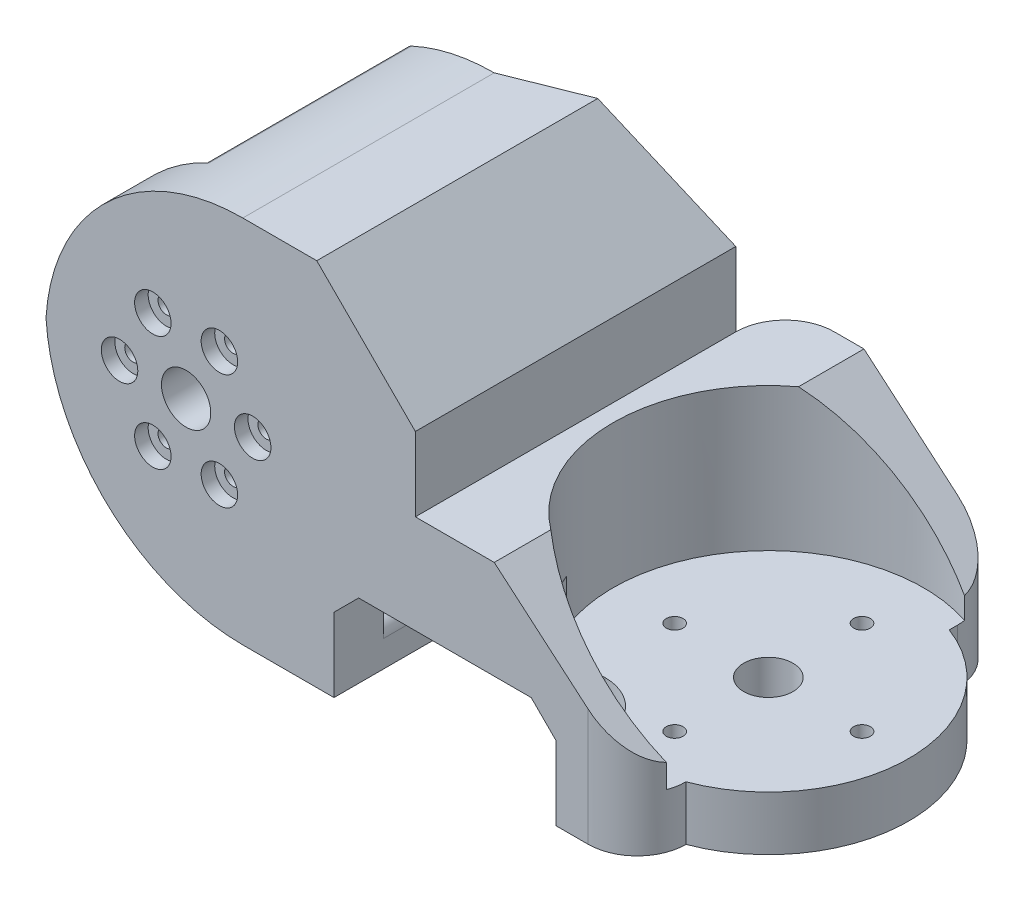
from build123d import *

# Parameters (mm, degrees)
SKETCH_1_W           = 140
SKETCH_1_H           = 75
EXTRUDE_1_DEPTH      = 75
SKETCH_2_R           = 5
SKETCH_2_R_2         = 1.7
CUT_EXTRUDE_3_DEPTH  = 75
SKETCH_3_R           = 30
CUT_EXTRUDE_4_DEPTH  = 65
SKETCH_5_W           = 86.110755756
SKETCH_5_H           = 127.816531237
CUT_EXTRUDE_5_DEPTH  = 65
SKETCH_6_R           = 5
SKETCH_6_R_2         = 1.7
CUT_EXTRUDE_6_DEPTH  = 110.230261375
SKETCH_7_R           = 31.5
CUT_EXTRUDE_8_DEPTH  = 64
SKETCH_8_W           = 81.607165619
SKETCH_8_H           = 101.959181743
CUT_EXTRUDE_9_DEPTH  = 35
SKETCH_9_W           = 88.154882568
SKETCH_9_H           = 60
CUT_EXTRUDE_10_DEPTH = 41
SKETCH_10_W          = 45
SKETCH_10_H          = 50
CUT_EXTRUDE_11_DEPTH = 20
FILLET_2_R           = 10
SKETCH_12_W          = 15
SKETCH_12_H          = 75
CUT_EXTRUDE_13_DEPTH = 29
CUT_EXTRUDE_14_DEPTH = 90
CUT_EXTRUDE_15_DEPTH = 20
CHAMFER_1_SIZE       = 5
CHAMFER_2_SIZE       = 5
CHAMFER_3_SIZE       = 3.631453243
CHAMFER_4_SIZE       = 25
CUT_EXTRUDE_16_DEPTH = 90
FILLET_4_R           = 40
FILLET_9_R           = 10
CUT_EXTRUDE_17_DEPTH = 90
FILLET_10_R          = 10
FILLET_11_R          = 2
FILLET_12_R          = 15
CHAMFER_5_SIZE       = 20
FILLET_13_R          = 3
SKETCH_20_R          = 3.7
CUT_EXTRUDE_18_DEPTH = 2.75
SKETCH_21_R          = 3.7
CUT_EXTRUDE_19_DEPTH = 5.5
EXTRUDE_START        = 7.25
SKETCH_22_R          = 28
SKETCH_22_R_2        = 5
SKETCH_22_R_3        = 1.7
EXTRUDE_2_DEPTH      = 7.25


# Some blends are built 0.0001 mm under size
with BuildPart() as part:
    # 草图1 → 凸台-拉伸1 (new body)
    with BuildSketch(Plane(origin=(0, 0, 0), x_dir=(1, 0, 0), z_dir=(0, 1, 0))):
        Rectangle(SKETCH_1_W, SKETCH_1_H)
    extrude(amount=EXTRUDE_1_DEPTH)

    # 草图2 → 切除-拉伸3 (cut)
    with BuildSketch(Plane(origin=(0, 0, -37.5), x_dir=(-1, 0, 0), z_dir=(0, 0, -1))):
        with Locations((41.5, 37.5)):
            Circle(SKETCH_2_R)
        with Locations((55, 37.5)):
            Circle(SKETCH_2_R_2)
        with Locations((48.25, 25.808657049)):
            Circle(SKETCH_2_R_2)
        with Locations((34.75, 25.808657049)):
            Circle(SKETCH_2_R_2)
        with Locations((28, 37.5)):
            Circle(SKETCH_2_R_2)
        with Locations((34.75, 49.191342951)):
            Circle(SKETCH_2_R_2)
        with Locations((48.25, 49.191342951)):
            Circle(SKETCH_2_R_2)
    extrude(amount=-CUT_EXTRUDE_3_DEPTH, mode=Mode.SUBTRACT)

    # 草图3 → 切除-拉伸4 (cut)
    with BuildSketch(Plane(origin=(0, 0, -37.5), x_dir=(-1, 0, 0), z_dir=(0, 0, -1))):
        with Locations((41.5, 37.5)):
            Circle(SKETCH_3_R)
    extrude(amount=-CUT_EXTRUDE_4_DEPTH, mode=Mode.SUBTRACT)

    # 草图5 → 切除-拉伸5 (cut)
    with BuildSketch(Plane.ZY.offset(70)):
        with Locations((-56.555377878, 38.847801736)):
            Rectangle(SKETCH_5_W, SKETCH_5_H)
    extrude(amount=-CUT_EXTRUDE_5_DEPTH, mode=Mode.SUBTRACT)

    # 草图6 → 切除-拉伸6 (cut, through all)
    with BuildSketch(Plane(origin=(0, 75, 0), x_dir=(1, 0, 0), z_dir=(0, 1, 0))):
        with Locations(Location((40, -0.9, 0), (0, 0, 270))):
            Circle(SKETCH_6_R)
        with Locations(Location((59, -0.9, 0), (0, 0, 270))):
            Circle(SKETCH_6_R_2)
        with Locations(Location((40, -19.9, 0), (0, 0, 270))):
            Circle(SKETCH_6_R_2)
        with Locations(Location((21, -0.9, 0), (0, 0, 270))):
            Circle(SKETCH_6_R_2)
        with Locations(Location((40, 18.1, 0), (0, 0, 270))):
            Circle(SKETCH_6_R_2)
    extrude(amount=-CUT_EXTRUDE_6_DEPTH, mode=Mode.SUBTRACT)

    # 草图7 → 切除-拉伸8 (cut)
    with BuildSketch(Plane(origin=(0, 75, 0), x_dir=(1, 0, 0), z_dir=(0, 1, 0))):
        with Locations((40, -0.9)):
            Circle(SKETCH_7_R)
    extrude(amount=-CUT_EXTRUDE_8_DEPTH, mode=Mode.SUBTRACT)

    # 草图8 → 切除-拉伸9 (cut)
    with BuildSketch(Plane(origin=(0, 75, 0), x_dir=(1, 0, 0), z_dir=(0, 1, 0))):
        with Locations((45.803582809, 9.868709537)):
            Rectangle(SKETCH_8_W, SKETCH_8_H)
    extrude(amount=-CUT_EXTRUDE_9_DEPTH, mode=Mode.SUBTRACT)

    # 草图9 → 切除-拉伸10 (cut)
    with BuildSketch(Plane(origin=(0, 0, -13.5), x_dir=(-1, 0, 0), z_dir=(0, 0, -1))):
        with Locations((49.077441284, 37.5)):
            Rectangle(SKETCH_9_W, SKETCH_9_H)
    extrude(amount=-CUT_EXTRUDE_10_DEPTH, mode=Mode.SUBTRACT)

    # 草图10 → 切除-拉伸11 (cut)
    with BuildSketch(Plane.XY.offset(37.5)):
        with Locations((11, -5)):
            Rectangle(SKETCH_10_W, SKETCH_10_H)
    extrude(amount=-CUT_EXTRUDE_11_DEPTH, mode=Mode.SUBTRACT)

    # 圆角2
    fillet_2_edges = [part.edges().sort_by_distance(p)[0] for p in [
        (33.5, 5.5, 17.5),
    ]]
    fillet(fillet_2_edges, radius=FILLET_2_R)

    # 草图12 → 切除-拉伸13 (cut)
    with BuildSketch(Plane(origin=(0, 40, 0), x_dir=(1, 0, 0), z_dir=(0, 1, 0))):
        with Locations((62.5, 0)):
            Rectangle(SKETCH_12_W, SKETCH_12_H)
    extrude(amount=-CUT_EXTRUDE_13_DEPTH, mode=Mode.SUBTRACT)

    # 草图13 → 切除-拉伸14 (cut)
    with BuildSketch(Plane.XY.offset(37.5)):
        Polygon((21, 40), (55, 11), (55, 40), align=None)
    extrude(amount=-CUT_EXTRUDE_14_DEPTH, mode=Mode.SUBTRACT)

    # 草图14 → 切除-拉伸15 (cut)
    with BuildSketch(Plane.XZ):
        with BuildLine():
            Line((50, -25.78801229), (50, -49.043195076))
            Line((50, -49.043195076), (107.000534674, -49.043195076))
            Line((107.000534674, -49.043195076), (107.000534674, 45.470511991))
            Line((107.000534674, 45.470511991), (50, 45.470511991))
            Line((50, 45.470511991), (50, 27.58801229))
            ThreePointArc((50, 27.58801229), (68.5, 0.9), (50, -25.78801229))
        make_face()
    extrude(amount=-CUT_EXTRUDE_15_DEPTH, mode=Mode.SUBTRACT)

    # 倒角1
    chamfer_1_edges = [part.edges().sort_by_distance(p)[0] for p in [
        (-11.5, 20, 32.5),
        (33.5, 20, 34.611035007),
    ]]
    chamfer(chamfer_1_edges, length=CHAMFER_1_SIZE)

    # 倒角2
    chamfer_2_edges = [part.edges().sort_by_distance(p)[0] for p in [
        (-5, 20, 22.5),
    ]]
    chamfer(chamfer_2_edges, length=CHAMFER_2_SIZE)

    # 倒角3
    # the kernel refuses this chamfer: 5, 3.631453243 mm, written as the material it takes off along each edge
    with BuildSketch(Plane(origin=(13.228933529, 11, 17.5), x_dir=(-0.4507563772017135, 0, -0.8926470122125466), z_dir=(0, 1, 0))) as chamfer_3_piece_1:
        with BuildLine():
            Line((5.501422933, 0), (CHAMFER_3_SIZE * 0.450756377234, CHAMFER_3_SIZE * 0.892647012276))
            Line((CHAMFER_3_SIZE * 0.450756377234, CHAMFER_3_SIZE * 0.892647012276), (0, 0))
            ThreePointArc((0, 0), (2.827778177, 0.120237365), (5.501422933, 0))
        make_face()
    extrude(amount=9, mode=Mode.SUBTRACT)

    # 倒角4
    # the kernel refuses this chamfer: 25 mm, written as the material it adds along each edge
    with BuildSketch(Plane(origin=(-5, 0, -13.5), x_dir=(0, 0, -1), z_dir=(0, 1, 0))) as chamfer_4_piece_1_section:
        Polygon((CHAMFER_4_SIZE, 0), (0, CHAMFER_4_SIZE), (0, 0), align=None)
    chamfer_4_piece_1 = extrude(amount=7.5, mode=Mode.PRIVATE)
    chamfer_4_piece_1 = split(chamfer_4_piece_1, bisect_by=Plane(origin=(-5, 0, -37.5), z_dir=(0, 0, 1)), keep=Keep.TOP, mode=Mode.PRIVATE)
    add(chamfer_4_piece_1)
    with BuildSketch(Plane(origin=(-5, 0, -13.5), x_dir=(0, 0, -1), z_dir=(0, 1, 0))) as chamfer_4_piece_2_section:
        Polygon((CHAMFER_4_SIZE, 0), (0, CHAMFER_4_SIZE), (0, 0), align=None)
    chamfer_4_piece_2 = extrude(amount=71.792074699, mode=Mode.PRIVATE)
    chamfer_4_piece_2 = split(chamfer_4_piece_2, bisect_by=Plane(origin=(-5, 0, -37.5), z_dir=(0, 0, 1)), keep=Keep.TOP, mode=Mode.PRIVATE)
    chamfer_4_piece_2 = split(chamfer_4_piece_2, bisect_by=Plane(origin=(-5, 67.5, -13.5), z_dir=(0, 1, 0)), keep=Keep.TOP, mode=Mode.PRIVATE)
    add(chamfer_4_piece_2)
    with BuildSketch(Plane(origin=(-5, 3.207925301, -13.5), x_dir=(0, 0, -1), z_dir=(0, 1, 0))) as chamfer_4_piece_3_section:
        Polygon((CHAMFER_4_SIZE, 0), (0, CHAMFER_4_SIZE), (0, 0), align=None)
    chamfer_4_piece_3 = extrude(amount=71.792074699, mode=Mode.PRIVATE)
    chamfer_4_piece_3 = split(chamfer_4_piece_3, bisect_by=Plane(origin=(-5, 3.207925301, -37.5), z_dir=(0, 0, 1)), keep=Keep.TOP, mode=Mode.PRIVATE)
    chamfer_4_piece_3 = split(chamfer_4_piece_3, bisect_by=Plane(origin=(-5, 7.5, -13.5), z_dir=(0, -1, 0)), keep=Keep.TOP, mode=Mode.PRIVATE)
    add(chamfer_4_piece_3)
    with BuildSketch(Plane(origin=(-5, 67.5, -13.5), x_dir=(0, 0, -1), z_dir=(0, 1, 0))) as chamfer_4_piece_4_section:
        Polygon((CHAMFER_4_SIZE, 0), (0, CHAMFER_4_SIZE), (0, 0), align=None)
    chamfer_4_piece_4 = extrude(amount=7.5, mode=Mode.PRIVATE)
    chamfer_4_piece_4 = split(chamfer_4_piece_4, bisect_by=Plane(origin=(-5, 67.5, -37.5), z_dir=(0, 0, 1)), keep=Keep.TOP, mode=Mode.PRIVATE)
    add(chamfer_4_piece_4)

    # 草图18 → 切除-拉伸16 (cut)
    with BuildSketch(Plane(origin=(0, 75, 0), x_dir=(1, 0, 0), z_dir=(0, 1, 0))):
        Polygon((5, 37.5), (-30, 13.5), (-17.082794304, 37.696917135), align=None)
    extrude(amount=-CUT_EXTRUDE_16_DEPTH, mode=Mode.SUBTRACT)

    # 圆角4
    # the kernel refuses this fillet: 40 mm, written as the material it takes off along each edge
    with BuildSketch(Plane(origin=(-70, 0, 137.5), x_dir=(0, 1, 0), z_dir=(0, 0, -1)), Plane(origin=(-70, 75, 137.5), x_dir=(1, 0, 0), z_dir=(0, 0, -1))) as fillet_4_piece_1:
        with BuildLine():
            CenterArc((FILLET_4_R, FILLET_4_R), FILLET_4_R, 180, 90)
            Line((0, FILLET_4_R), (0, 0))
            Line((0, 0), (FILLET_4_R, 0))
        make_face()
    extrude(amount=251, mode=Mode.SUBTRACT)

    # 圆角9
    # the kernel refuses this fillet: 10 mm, written as the material it takes off along each edge
    with BuildSketch(Plane(origin=(50, -25, -37.5), x_dir=(-1, 0, 0), z_dir=(0, 1, 0))) as fillet_9_piece_1:
        with BuildLine():
            CenterArc((FILLET_9_R, FILLET_9_R), FILLET_9_R, 180, 90)
            Line((0, FILLET_9_R), (0, 0))
            Line((0, 0), (FILLET_9_R, 0))
        make_face()
    extrude(amount=65.264705882, mode=Mode.SUBTRACT)
    with BuildSketch(Plane(origin=(50, 40.264705882, 37.5), x_dir=(-1, 0, 0), z_dir=(0, -1, 0))) as fillet_9_piece_2_section:
        with BuildLine():
            CenterArc((FILLET_9_R, FILLET_9_R), FILLET_9_R, 180, 90)
            Line((0, FILLET_9_R), (0, 0))
            Line((0, 0), (FILLET_9_R, 0))
        make_face()
    fillet_9_piece_2 = extrude(amount=65.264705882, mode=Mode.PRIVATE)
    fillet_9_piece_2 = fillet_9_piece_2 - Plane(origin=(40, 40.264705882, 0.9), x_dir=(0.35087719298245684, 0, 0.9364214838654397), z_dir=(0, -1, 0)) * Cylinder(28.5, 171, mode=Mode.PRIVATE)
    add(fillet_9_piece_2, mode=Mode.SUBTRACT)

    # 草图19 → 切除-拉伸17 (cut)
    with BuildSketch(Plane(origin=(0, 75, 0), x_dir=(1, 0, 0), z_dir=(0, 1, 0))):
        Polygon((-30, 13.5), (5, 27.5), (5, 42.665451474), align=None)
    extrude(amount=-CUT_EXTRUDE_17_DEPTH, mode=Mode.SUBTRACT)

    # 圆角10
    fillet_10_edges = [part.edges().sort_by_distance(p)[0] for p in [
        (5, 20, -37.5),
    ]]
    fillet(fillet_10_edges, radius=FILLET_10_R - 0.0001)  # a hair under: the kernel refuses the full size

    # 圆角11
    fillet_11_edges = [part.edges().sort_by_distance(p)[0] for p in [
        (-53.318447633, 7.5, 7),
        (-53.318447633, 67.5, 7),
    ]]
    fillet(fillet_11_edges, radius=FILLET_11_R)

    # 圆角12
    fillet_12_edges = [part.edges().sort_by_distance(p)[0] for p in [
        (-5, 7.5, -3),
        (-5, 67.5, 2),
    ]]
    fillet(fillet_12_edges, radius=FILLET_12_R)

    # 倒角5
    chamfer_5_edges = [part.edges().sort_by_distance(p)[0] for p in [
        (5, 75, 5),
    ]]
    chamfer(chamfer_5_edges, length=CHAMFER_5_SIZE)

    # 圆角13
    # the kernel refuses this fillet: 3 mm, written as the material it takes off along each edge
    with BuildSketch(Plane(origin=(-5, 32.5, 17.5), x_dir=(0, 0, -1), z_dir=(0, -1, 0))) as fillet_13_piece_1_section:
        with BuildLine():
            CenterArc((FILLET_13_R, FILLET_13_R), FILLET_13_R, 180, 90)
            Line((0, FILLET_13_R), (0, 0))
            Line((0, 0), (FILLET_13_R, 0))
        make_face()
    fillet_13_piece_1 = extrude(amount=10, mode=Mode.PRIVATE)
    fillet_13_piece_1 = split(fillet_13_piece_1, bisect_by=Plane(origin=(-8.75, 28.75, 17.5), z_dir=(-0.7071067811865476, -0.7071067811865476, 0)), keep=Keep.TOP, mode=Mode.PRIVATE)
    add(fillet_13_piece_1, mode=Mode.SUBTRACT)
    with BuildSketch(Plane(origin=(-20, 22.5, 17.5), x_dir=(1, 0, 0), z_dir=(0, 1, 0))) as fillet_13_piece_2_section:
        with BuildLine():
            CenterArc((15 + FILLET_13_R, FILLET_13_R), FILLET_13_R, 180, 90)
            Line((15 + FILLET_13_R, 0), (15, 0))
            Line((15, 0), (15, FILLET_13_R))
        make_face()
    fillet_13_piece_2 = revolve(axis=Axis((-20, 22.5, 17.5), (0, 0, -1)), revolution_arc=84.134154569, mode=Mode.PRIVATE)
    fillet_13_piece_2 = split(fillet_13_piece_2, bisect_by=Plane(origin=(-11.5, 22.5, 17.5), z_dir=(1, 0, 0)), keep=Keep.TOP, mode=Mode.PRIVATE)
    fillet_13_piece_2 = split(fillet_13_piece_2, bisect_by=Plane(origin=(-11.25, 31.25, 17.5), z_dir=(-0.7071067811865476, -0.7071067811865476, 0)), keep=Keep.TOP, mode=Mode.PRIVATE)
    add(fillet_13_piece_2, mode=Mode.SUBTRACT)
    with BuildSketch(Plane(origin=(-11.5, 10.140792906, 17.5), x_dir=(-0.8976060108994353, -0.44079864926880474, 0), z_dir=(0, 0, 1))) as fillet_13_piece_3:
        with BuildLine():
            CenterArc((4.799804459, 2.968097419), FILLET_13_R, 153.845150793, 107.791590573)
            Line((2.106986426, 4.290493367), (0, 0))
            ThreePointArc((0, 0), (2.181729299, 0.159512903), (4.363458599, 0))
        make_face()
    extrude(amount=10, mode=Mode.SUBTRACT)
    with BuildSketch(Plane(origin=(-20, 22.5, 17.5), x_dir=(1, 0, 0), z_dir=(0, 1, 0))) as fillet_13_piece_4a_section:
        with BuildLine():
            CenterArc((15 + FILLET_13_R, FILLET_13_R), FILLET_13_R, 180, 90)
            Line((15 + FILLET_13_R, 0), (15, 0))
            Line((15, 0), (15, FILLET_13_R))
        make_face()
    fillet_13_piece_4a = revolve(axis=Axis((-20, 22.5, 17.5), (0, 0, -1)), revolution_arc=84.134154569, mode=Mode.PRIVATE)
    fillet_13_piece_4a = split(fillet_13_piece_4a, bisect_by=Plane(origin=(-11.5, 22.5, 17.5), z_dir=(-1, 0, 0)), keep=Keep.TOP, mode=Mode.PRIVATE)
    with BuildSketch(Plane(origin=(-11.5, 10.140792906, 5.550176483), x_dir=(-0.8976060108994353, -0.44079864926880474, 0), z_dir=(0, 0, 1))) as fillet_13_piece_4b_section:
        with BuildLine():
            CenterArc((4.799804459, 2.968097419), FILLET_13_R, 153.845150793, 107.791590573)
            Line((2.106986426, 4.290493367), (0, 0))
            ThreePointArc((0, 0), (2.181729299, 0.159512903), (4.363458599, 0))
        make_face()
    fillet_13_piece_4b = extrude(amount=21.949823517, mode=Mode.PRIVATE)
    fillet_13_piece_4b = split(fillet_13_piece_4b, bisect_by=Plane(origin=(-11.5, 10.140792906, 17.5), z_dir=(0, 0, -1)), keep=Keep.TOP, mode=Mode.PRIVATE)
    fillet_13_piece_4 = fillet_13_piece_4a & fillet_13_piece_4b
    add(fillet_13_piece_4, mode=Mode.SUBTRACT)

    # 草图20 → 切除-拉伸18 (cut)
    with BuildSketch(Plane.XY.offset(37.5)):
        with Locations((-34.75, 49.191342951)):
            Circle(SKETCH_20_R)
        with Locations((-48.25, 49.191342951)):
            Circle(SKETCH_20_R)
        with Locations((-55, 37.5)):
            Circle(SKETCH_20_R)
        with Locations((-48.25, 25.808657049)):
            Circle(SKETCH_20_R)
        with Locations((-34.75, 25.808657049)):
            Circle(SKETCH_20_R)
        with Locations((-28, 37.5)):
            Circle(SKETCH_20_R)
    extrude(amount=-CUT_EXTRUDE_18_DEPTH, mode=Mode.SUBTRACT)

    # 草图21 → 切除-拉伸19 (cut)
    with BuildSketch(Plane.XZ):
        with Locations(Location((40, -18.1, 0), (0, 0, 270))):
            Circle(SKETCH_21_R)
        with Locations(Location((21, 0.9, 0), (0, 0, 270))):
            Circle(SKETCH_21_R)
        with Locations(Location((40, 19.9, 0), (0, 0, 270))):
            Circle(SKETCH_21_R)
        with Locations(Location((59, 0.9, 0), (0, 0, 270))):
            Circle(SKETCH_21_R)
    extrude(amount=-CUT_EXTRUDE_19_DEPTH, mode=Mode.SUBTRACT)

    # 草图22 → 凸台-拉伸2 (add)
    with BuildSketch(Plane(origin=(0, 0, 27.5), x_dir=(-1, 0, 0), z_dir=(0, 0, -1)).offset(EXTRUDE_START)):
        with Locations(Location((41.5, 37.5, 0), (0, 0, 180))):
            Circle(SKETCH_22_R)
        with Locations((41.5, 37.5)):
            Circle(SKETCH_22_R_2, mode=Mode.SUBTRACT)
        with Locations((48.25, 49.191342951)):
            Circle(SKETCH_22_R_3, mode=Mode.SUBTRACT)
        with Locations((34.75, 49.191342951)):
            Circle(SKETCH_22_R_3, mode=Mode.SUBTRACT)
        with Locations((28, 37.5)):
            Circle(SKETCH_22_R_3, mode=Mode.SUBTRACT)
        with Locations((34.75, 25.808657049)):
            Circle(SKETCH_22_R_3, mode=Mode.SUBTRACT)
        with Locations((48.25, 25.808657049)):
            Circle(SKETCH_22_R_3, mode=Mode.SUBTRACT)
        with Locations((55, 37.5)):
            Circle(SKETCH_22_R_3, mode=Mode.SUBTRACT)
    extrude(amount=-EXTRUDE_2_DEPTH)


solid = part.part
